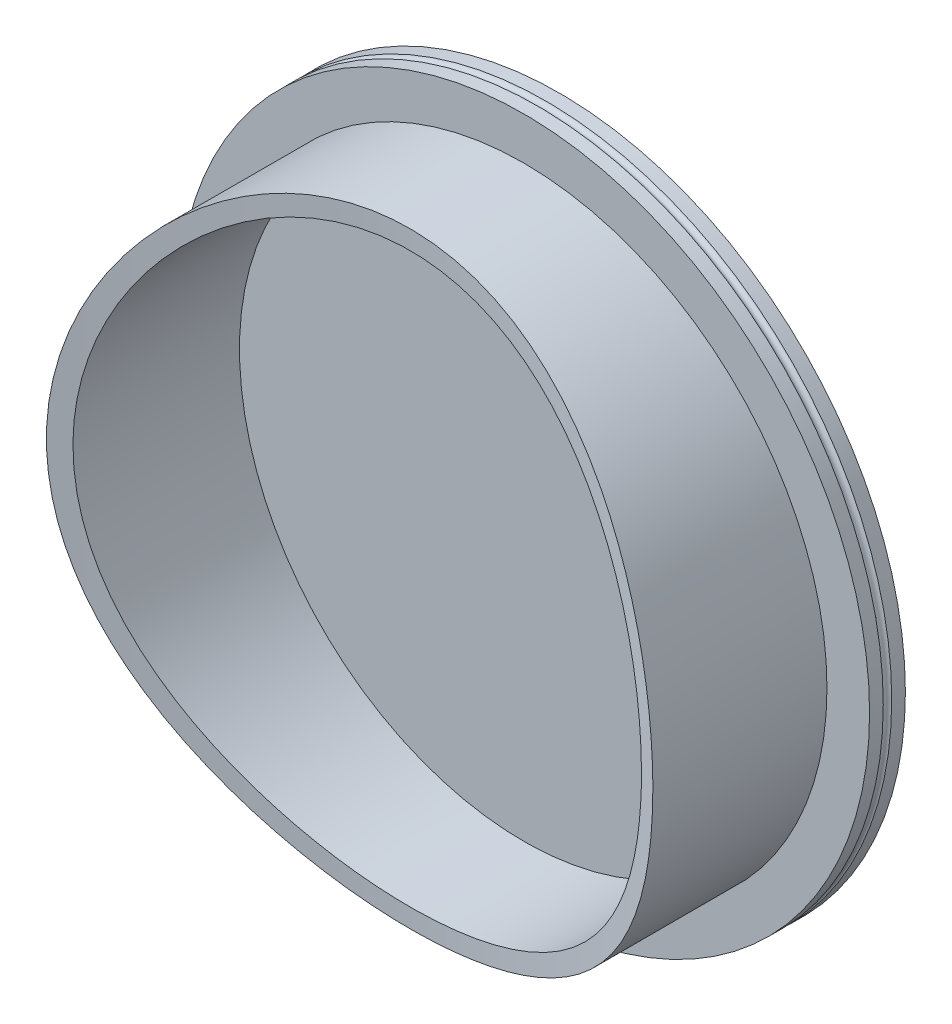
from build123d import *

# Parameters (mm, degrees)
CUT_EXTRUDE1_DEPTH      = 181.428050054
CUT_EXTRUDE1_DEPTH_BACK = 181.428050054
EXTERNAL_EXTRUSION_R    = 264.929999984


with BuildPart() as part:
    # Sketch1 → Base-Revolve (revolve)
    with BuildSketch(Plane(origin=(0, 0, 0), x_dir=(0, 0, -1), z_dir=(1, 0, 0))):
        with BuildLine():
            Line((-4.585786438, 115.874999992), (0, 115.874999992))
            Line((0, 115.874999992), (0, 113.374999974))
            Line((0, 113.374999974), (-2, 113.374999974))
            Line((-2, 113.374999974), (-2, 107.374999974))
            Line((-2, 107.374999974), (0, 107.374999974))
            Line((0, 107.374999974), (0, 0))
            Line((0, 0), (-12, 0))
            Line((-12, 0), (-12, 95.25))
            Line((-12, 95.25), (-75.5, 95.25))
            Line((-75.5, 95.25), (-75.5, 101.6))
            Line((-75.5, 101.6), (-12, 101.6))
            Line((-12, 101.6), (-12, 115.874999992))
            Line((-12, 115.874999992), (-7.414213562, 115.874999992))
            ThreePointArc((-7.414213562, 115.874999992), (-6, 114.874999992), (-4.585786438, 115.874999992))
        make_face()
    revolve(axis=Axis((0, 0, 12), (0, 0, -1)))

    # External extrusion → Cut-Extrude1 (cut, two sides: drawn at the far end of the back side and taken through both)
    with BuildSketch(Plane(origin=(0, 0, 0), x_dir=(1, 0, 0), z_dir=(0, 1, 0)).offset(-CUT_EXTRUDE1_DEPTH_BACK)):
        with Locations((0, -315.021800044)):
            Circle(EXTERNAL_EXTRUSION_R)
    extrude(amount=CUT_EXTRUDE1_DEPTH + CUT_EXTRUDE1_DEPTH_BACK, mode=Mode.SUBTRACT)


solid = part.part
